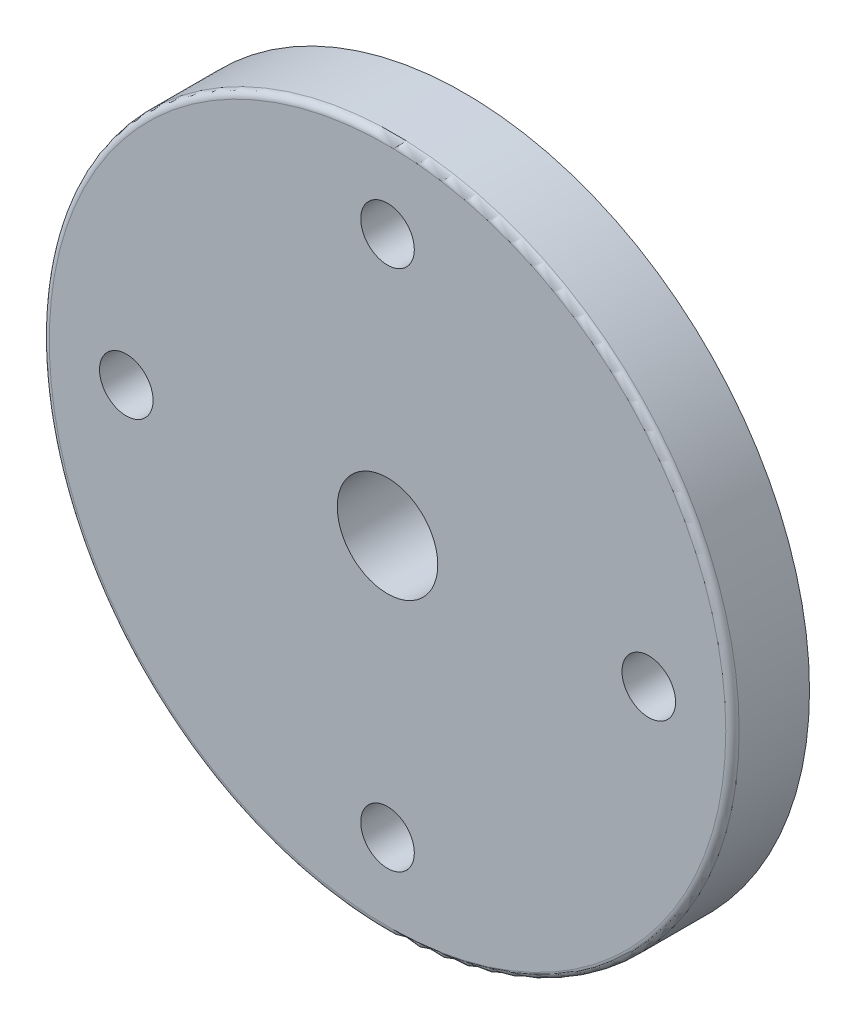
from build123d import *

# Parameters (mm, degrees)
SKETCH1_R           = 10.3
BOSS_EXTRUDE1_DEPTH = 2.3
SKETCH2_R           = 4.375
BOSS_EXTRUDE2_DEPTH = 3.2
SKETCH3_R           = 3
CUT_EXTRUDE1_DEPTH  = 2.75
SKETCH4_R           = 1.5
CUT_EXTRUDE2_DEPTH  = 16.570163776
SKETCH12_R          = 0.8
CUT_EXTRUDE10_DEPTH = 15.913752043
FILLET2_R           = 0.2
FILLET3_R           = 0.3


with BuildPart() as part:
    # Sketch1 → Boss-Extrude1 (new body)
    with BuildSketch(Plane(origin=(0, 0, -2.5), x_dir=(-1, 0, 0), z_dir=(0, 0, -1))):
        Circle(SKETCH1_R)
    extrude(amount=-BOSS_EXTRUDE1_DEPTH)

    # Sketch2 → Boss-Extrude2 (add)
    with BuildSketch(Plane(origin=(0, 0, -2.5), x_dir=(-1, 0, 0), z_dir=(0, 0, -1))):
        Circle(SKETCH2_R)
    extrude(amount=BOSS_EXTRUDE2_DEPTH)

    # Sketch3 → Cut-Extrude1 (cut)
    with BuildSketch(Plane(origin=(0, 0, -5.7), x_dir=(-1, 0, 0), z_dir=(0, 0, -1))):
        Circle(SKETCH3_R)
    extrude(amount=-CUT_EXTRUDE1_DEPTH, mode=Mode.SUBTRACT)

    # Sketch4 → Cut-Extrude2 (cut, through all)
    with BuildSketch(Plane.XY.offset(-0.2)):
        Circle(SKETCH4_R)
    extrude(amount=-CUT_EXTRUDE2_DEPTH, mode=Mode.SUBTRACT)

    # Sketch12 → Cut-Extrude10 (cut, through all)
    with BuildSketch(Plane(origin=(0, 0, -2.5), x_dir=(-1, 0, 0), z_dir=(0, 0, -1))):
        with Locations((0, 7.8)):
            Circle(SKETCH12_R)
        with Locations((7.8, 0)):
            Circle(SKETCH12_R)
        with Locations((0, -7.8)):
            Circle(SKETCH12_R)
        with Locations((-7.8, 0)):
            Circle(SKETCH12_R)
    extrude(amount=-CUT_EXTRUDE10_DEPTH, mode=Mode.SUBTRACT)

    # Fillet2
    fillet2_edges = [part.edges().sort_by_distance(p)[0] for p in [
        (10.3, 0, -0.2),
    ]]
    fillet(fillet2_edges, radius=FILLET2_R)

    # Fillet3
    fillet3_edges = [part.edges().sort_by_distance(p)[0] for p in [
        (4.375, 0, -5.7),
    ]]
    fillet(fillet3_edges, radius=FILLET3_R)


solid = part.part
